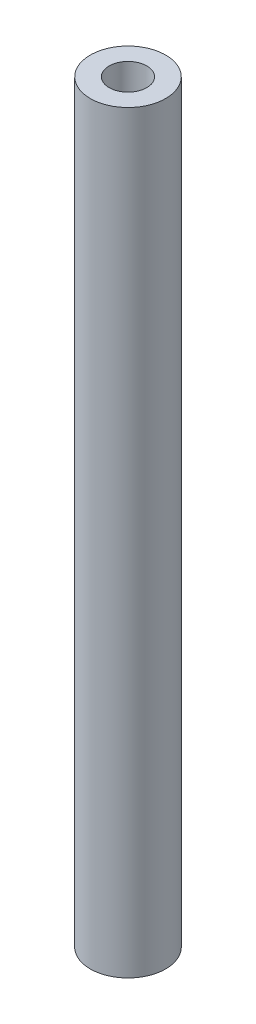
from build123d import *

# Parameters (mm, degrees)
SKETCH_2_R          = 4
EXTRUDE_1_DEPTH     = 80
SKETCH_3_R          = 2
CUT_EXTRUDE_1_DEPTH = 81.199750623


with BuildPart() as part:
    # 草图2 → 凸台-拉伸1 (new body)
    with BuildSketch(Plane(origin=(0, 0, 0), x_dir=(1, 0, 0), z_dir=(0, 1, 0))):
        Circle(SKETCH_2_R)
    extrude(amount=EXTRUDE_1_DEPTH)

    # 草图3 → 切除-拉伸1 (cut, through all)
    with BuildSketch(Plane(origin=(0, 80, 0), x_dir=(1, 0, 0), z_dir=(0, 1, 0))):
        Circle(SKETCH_3_R)
    extrude(amount=-CUT_EXTRUDE_1_DEPTH, mode=Mode.SUBTRACT)


solid = part.part
